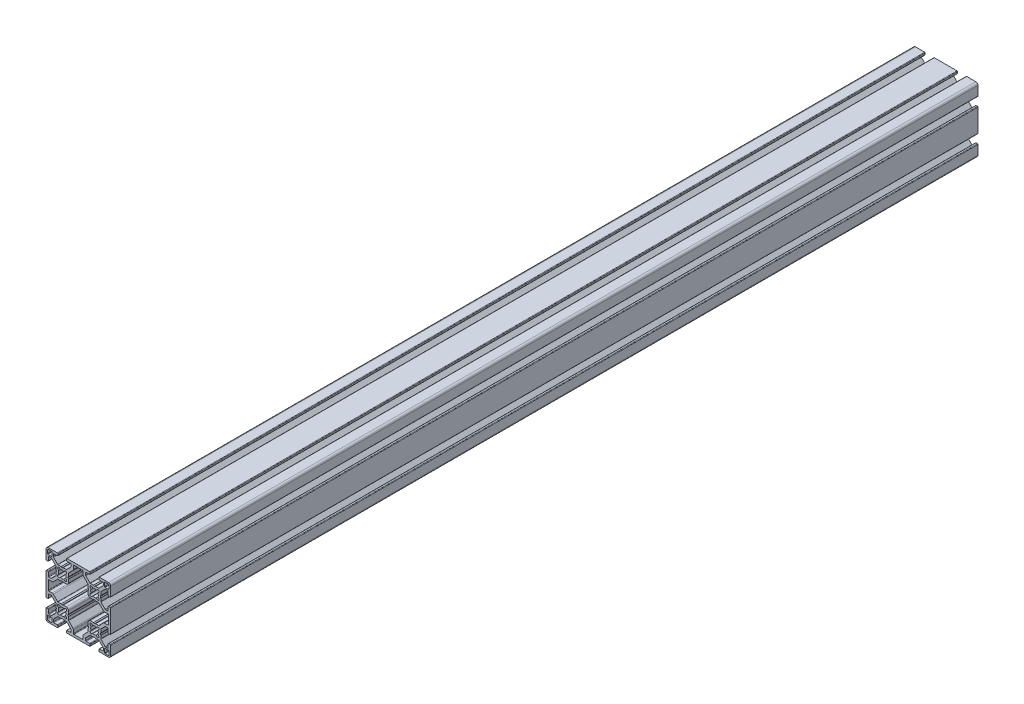
from build123d import *

# Parameters (mm, degrees)
EXTRUDE1_DEPTH     = 805
SKETCH2_R          = 3.175
CUT_EXTRUDE1_DEPTH = 809.486225919
SKETCH3_R          = 3.175
CUT_EXTRUDE2_DEPTH = 809.486226018


with BuildPart() as part:
    # Sketch1 → Extrude1 (new body)
    with BuildSketch(Plane.XY):
        with BuildLine():
            Line((-14.49997, -25.99994), (-13.242500135, -25.99994))
            ThreePointArc((-13.242500135, -25.99994), (-12.888946745, -25.853493391), (-12.742500135, -25.49994))
            Line((-12.742500135, -25.49994), (-12.742500135, -22.267405213))
            ThreePointArc((-12.742500135, -22.267405213), (-12.602474902, -21.902627009), (-12.242805721, -21.7499565))
            Line((-12.242805721, -21.7499565), (-10.260208553, -21.7499565))
            ThreePointArc((-10.260208553, -21.7499565), (-10.068867219, -21.788016658), (-9.906655869, -21.896402817))
            Line((-9.906655869, -21.896402817), (-5.981129731, -25.821928955))
            ThreePointArc((-5.981129731, -25.821928955), (-5.872743572, -25.984140305), (-5.834683414, -26.175481638))
            Line((-5.834683414, -26.175481638), (-5.834683414, -29.112441775))
            Line((-5.834683414, -29.112441775), (-5.324684434, -30.062439875))
            Line((-5.324684434, -30.062439875), (-5.834683414, -31.012437975))
            Line((-5.834683414, -31.012437975), (-5.834683414, -33.824398362))
            ThreePointArc((-5.834683414, -33.824398362), (-5.872743572, -34.015739695), (-5.981129731, -34.177951045))
            Line((-5.981129731, -34.177951045), (-9.906655869, -38.103477183))
            ThreePointArc((-9.906655869, -38.103477183), (-10.068867219, -38.211863342), (-10.260208553, -38.2499235))
            Line((-10.260208553, -38.2499235), (-12.242805721, -38.2499235))
            ThreePointArc((-12.242805721, -38.2499235), (-12.602474902, -38.097252991), (-12.742500135, -37.732474787))
            Line((-12.742500135, -37.732474787), (-12.742500135, -34.49994))
            ThreePointArc((-12.742500135, -34.49994), (-12.888946745, -34.146386609), (-13.242500135, -33.99994))
            Line((-13.242500135, -33.99994), (-14.49997, -33.99994))
            ThreePointArc((-14.49997, -33.99994), (-14.853523391, -34.146386609), (-14.99997, -34.49994))
            Line((-14.99997, -34.49994), (-14.99997, -42.999914))
            ThreePointArc((-14.99997, -42.999914), (-14.414184734, -44.414124734), (-12.999974, -44.99991))
            Line((-12.999974, -44.99991), (-4.5, -44.99991))
            ThreePointArc((-4.5, -44.99991), (-4.146446609, -44.853463391), (-4, -44.49991))
            Line((-4, -44.49991), (-4, -43.242440135))
            ThreePointArc((-4, -43.242440135), (-4.146446609, -42.888886745), (-4.5, -42.742440135))
            Line((-4.5, -42.742440135), (-7.732534787, -42.742440135))
            ThreePointArc((-7.732534787, -42.742440135), (-8.097312991, -42.602414902), (-8.2499835, -42.242745721))
            Line((-8.2499835, -42.242745721), (-8.2499835, -40.260148553))
            ThreePointArc((-8.2499835, -40.260148553), (-8.211923342, -40.068807219), (-8.103537183, -39.906595869))
            Line((-8.103537183, -39.906595869), (-4.178011045, -35.981069731))
            ThreePointArc((-4.178011045, -35.981069731), (-4.015799695, -35.872683572), (-3.824458362, -35.834623414))
            Line((-3.824458362, -35.834623414), (-0.9499981, -35.834623414))
            Line((-0.9499981, -35.834623414), (0, -35.324624434))
            Line((0, -35.324624434), (0.9499981, -35.834623414))
            Line((0.9499981, -35.834623414), (3.824458362, -35.834623414))
            ThreePointArc((3.824458362, -35.834623414), (4.015799695, -35.872683572), (4.178011045, -35.981069731))
            Line((4.178011045, -35.981069731), (8.103537183, -39.906595869))
            ThreePointArc((8.103537183, -39.906595869), (8.211923342, -40.068807219), (8.2499835, -40.260148553))
            Line((8.2499835, -40.260148553), (8.2499835, -42.242745721))
            ThreePointArc((8.2499835, -42.242745721), (8.097312991, -42.602414902), (7.732534787, -42.742440135))
            Line((7.732534787, -42.742440135), (4.5, -42.742440135))
            ThreePointArc((4.5, -42.742440135), (4.146446609, -42.888886745), (4, -43.242440135))
            Line((4, -43.242440135), (4, -44.49991))
            ThreePointArc((4, -44.49991), (4.146446609, -44.853463391), (4.5, -44.99991))
            Line((4.5, -44.99991), (25.49994, -44.99991))
            ThreePointArc((25.49994, -44.99991), (25.853493391, -44.853463391), (25.99994, -44.49991))
            Line((25.99994, -44.49991), (25.99994, -43.242440135))
            ThreePointArc((25.99994, -43.242440135), (25.853493391, -42.888886745), (25.49994, -42.742440135))
            Line((25.49994, -42.742440135), (22.267405213, -42.742440135))
            ThreePointArc((22.267405213, -42.742440135), (21.902627009, -42.602414902), (21.7499565, -42.242745721))
            Line((21.7499565, -42.242745721), (21.7499565, -40.260148553))
            ThreePointArc((21.7499565, -40.260148553), (21.788016658, -40.068807219), (21.896402817, -39.906595869))
            Line((21.896402817, -39.906595869), (25.821928955, -35.981069731))
            ThreePointArc((25.821928955, -35.981069731), (25.984140305, -35.872683572), (26.175481638, -35.834623414))
            Line((26.175481638, -35.834623414), (29.0499419, -35.834623414))
            Line((29.0499419, -35.834623414), (29.99994, -35.324624434))
            Line((29.99994, -35.324624434), (30.9499381, -35.834623414))
            Line((30.9499381, -35.834623414), (33.824398362, -35.834623414))
            ThreePointArc((33.824398362, -35.834623414), (34.015739695, -35.872683572), (34.177951045, -35.981069731))
            Line((34.177951045, -35.981069731), (38.103477183, -39.906595869))
            ThreePointArc((38.103477183, -39.906595869), (38.211863342, -40.068807219), (38.2499235, -40.260148553))
            Line((38.2499235, -40.260148553), (38.2499235, -42.242745721))
            ThreePointArc((38.2499235, -42.242745721), (38.097252991, -42.602414902), (37.732474787, -42.742440135))
            Line((37.732474787, -42.742440135), (34.49994, -42.742440135))
            ThreePointArc((34.49994, -42.742440135), (34.146386609, -42.888886745), (33.99994, -43.242440135))
            Line((33.99994, -43.242440135), (33.99994, -44.49991))
            ThreePointArc((33.99994, -44.49991), (34.146386609, -44.853463391), (34.49994, -44.99991))
            Line((34.49994, -44.99991), (42.999914, -44.99991))
            ThreePointArc((42.999914, -44.99991), (44.414124734, -44.414124734), (44.99991, -42.999914))
            Line((44.99991, -42.999914), (44.99991, -34.49994))
            ThreePointArc((44.99991, -34.49994), (44.853463391, -34.146386609), (44.49991, -33.99994))
            Line((44.49991, -33.99994), (43.242440135, -33.99994))
            ThreePointArc((43.242440135, -33.99994), (42.888886745, -34.146386609), (42.742440135, -34.49994))
            Line((42.742440135, -34.49994), (42.742440135, -37.732474787))
            ThreePointArc((42.742440135, -37.732474787), (42.602414902, -38.097252991), (42.242745721, -38.2499235))
            Line((42.242745721, -38.2499235), (40.260148553, -38.2499235))
            ThreePointArc((40.260148553, -38.2499235), (40.068807219, -38.211863342), (39.906595869, -38.103477183))
            Line((39.906595869, -38.103477183), (35.981069731, -34.177951045))
            ThreePointArc((35.981069731, -34.177951045), (35.872683572, -34.015739695), (35.834623414, -33.824398362))
            Line((35.834623414, -33.824398362), (35.834623414, -31.012437975))
            Line((35.834623414, -31.012437975), (35.324624434, -30.062439875))
            Line((35.324624434, -30.062439875), (35.834623414, -29.112441775))
            Line((35.834623414, -29.112441775), (35.834623414, -26.175481638))
            ThreePointArc((35.834623414, -26.175481638), (35.872683572, -25.984140305), (35.981069731, -25.821928955))
            Line((35.981069731, -25.821928955), (39.906595869, -21.896402817))
            ThreePointArc((39.906595869, -21.896402817), (40.068807219, -21.788016658), (40.260148553, -21.7499565))
            Line((40.260148553, -21.7499565), (42.242745721, -21.7499565))
            ThreePointArc((42.242745721, -21.7499565), (42.602414902, -21.902627009), (42.742440135, -22.267405213))
            Line((42.742440135, -22.267405213), (42.742440135, -25.49994))
            ThreePointArc((42.742440135, -25.49994), (42.888886745, -25.853493391), (43.242440135, -25.99994))
            Line((43.242440135, -25.99994), (44.49991, -25.99994))
            ThreePointArc((44.49991, -25.99994), (44.853463391, -25.853493391), (44.99991, -25.49994))
            Line((44.99991, -25.49994), (44.99991, -4.5))
            ThreePointArc((44.99991, -4.5), (44.853463391, -4.146446609), (44.49991, -4))
            Line((44.49991, -4), (43.242440135, -4))
            ThreePointArc((43.242440135, -4), (42.888886745, -4.146446609), (42.742440135, -4.5))
            Line((42.742440135, -4.5), (42.742440135, -7.732534787))
            ThreePointArc((42.742440135, -7.732534787), (42.602414902, -8.097312991), (42.242745721, -8.2499835))
            Line((42.242745721, -8.2499835), (40.260148553, -8.2499835))
            ThreePointArc((40.260148553, -8.2499835), (40.068807219, -8.211923342), (39.906595869, -8.103537183))
            Line((39.906595869, -8.103537183), (35.981069731, -4.178011045))
            ThreePointArc((35.981069731, -4.178011045), (35.872683572, -4.015799695), (35.834623414, -3.824458362))
            Line((35.834623414, -3.824458362), (35.834623414, -1.012497975))
            Line((35.834623414, -1.012497975), (35.324624434, -0.062499875))
            Line((35.324624434, -0.062499875), (35.834623414, 0.887498225))
            Line((35.834623414, 0.887498225), (35.834623414, 3.824458362))
            ThreePointArc((35.834623414, 3.824458362), (35.872683572, 4.015799695), (35.981069731, 4.178011045))
            Line((35.981069731, 4.178011045), (39.906595869, 8.103537183))
            ThreePointArc((39.906595869, 8.103537183), (40.068807219, 8.211923342), (40.260148553, 8.2499835))
            Line((40.260148553, 8.2499835), (42.242745721, 8.2499835))
            ThreePointArc((42.242745721, 8.2499835), (42.602414902, 8.097312991), (42.742440135, 7.732534787))
            Line((42.742440135, 7.732534787), (42.742440135, 4.5))
            ThreePointArc((42.742440135, 4.5), (42.888886745, 4.146446609), (43.242440135, 4))
            Line((43.242440135, 4), (44.49991, 4))
            ThreePointArc((44.49991, 4), (44.853463391, 4.146446609), (44.99991, 4.5))
            Line((44.99991, 4.5), (44.99991, 12.999974))
            ThreePointArc((44.99991, 12.999974), (44.414124734, 14.414184734), (42.999914, 14.99997))
            Line((42.999914, 14.99997), (34.49994, 14.99997))
            ThreePointArc((34.49994, 14.99997), (34.146386609, 14.853523391), (33.99994, 14.49997))
            Line((33.99994, 14.49997), (33.99994, 13.242500135))
            ThreePointArc((33.99994, 13.242500135), (34.146386609, 12.888946745), (34.49994, 12.742500135))
            Line((34.49994, 12.742500135), (37.732474787, 12.742500135))
            ThreePointArc((37.732474787, 12.742500135), (38.097252991, 12.602474902), (38.2499235, 12.242805721))
            Line((38.2499235, 12.242805721), (38.2499235, 10.260208553))
            ThreePointArc((38.2499235, 10.260208553), (38.211863342, 10.068867219), (38.103477183, 9.906655869))
            Line((38.103477183, 9.906655869), (34.177951045, 5.981129731))
            ThreePointArc((34.177951045, 5.981129731), (34.015739695, 5.872743572), (33.824398362, 5.834683414))
            Line((33.824398362, 5.834683414), (30.9499381, 5.834683414))
            Line((30.9499381, 5.834683414), (29.99994, 5.324684434))
            Line((29.99994, 5.324684434), (29.0499419, 5.834683414))
            Line((29.0499419, 5.834683414), (26.175481638, 5.834683414))
            ThreePointArc((26.175481638, 5.834683414), (25.984140305, 5.872743572), (25.821928955, 5.981129731))
            Line((25.821928955, 5.981129731), (21.896402817, 9.906655869))
            ThreePointArc((21.896402817, 9.906655869), (21.788016658, 10.068867219), (21.7499565, 10.260208553))
            Line((21.7499565, 10.260208553), (21.7499565, 12.242805721))
            ThreePointArc((21.7499565, 12.242805721), (21.902627009, 12.602474902), (22.267405213, 12.742500135))
            Line((22.267405213, 12.742500135), (25.49994, 12.742500135))
            ThreePointArc((25.49994, 12.742500135), (25.853493391, 12.888946745), (25.99994, 13.242500135))
            Line((25.99994, 13.242500135), (25.99994, 14.49997))
            ThreePointArc((25.99994, 14.49997), (25.853493391, 14.853523391), (25.49994, 14.99997))
            Line((25.49994, 14.99997), (4.5, 14.99997))
            ThreePointArc((4.5, 14.99997), (4.146446609, 14.853523391), (4, 14.49997))
            Line((4, 14.49997), (4, 13.242500135))
            ThreePointArc((4, 13.242500135), (4.146446609, 12.888946745), (4.5, 12.742500135))
            Line((4.5, 12.742500135), (7.732534787, 12.742500135))
            ThreePointArc((7.732534787, 12.742500135), (8.097312991, 12.602474902), (8.2499835, 12.242805721))
            Line((8.2499835, 12.242805721), (8.2499835, 10.260208553))
            ThreePointArc((8.2499835, 10.260208553), (8.211923342, 10.068867219), (8.103537183, 9.906655869))
            Line((8.103537183, 9.906655869), (4.178011045, 5.981129731))
            ThreePointArc((4.178011045, 5.981129731), (4.015799695, 5.872743572), (3.824458362, 5.834683414))
            Line((3.824458362, 5.834683414), (0.9499981, 5.834683414))
            Line((0.9499981, 5.834683414), (0, 5.324684434))
            Line((0, 5.324684434), (-0.9499981, 5.834683414))
            Line((-0.9499981, 5.834683414), (-3.824458362, 5.834683414))
            ThreePointArc((-3.824458362, 5.834683414), (-4.015799695, 5.872743572), (-4.178011045, 5.981129731))
            Line((-4.178011045, 5.981129731), (-8.103537183, 9.906655869))
            ThreePointArc((-8.103537183, 9.906655869), (-8.211923342, 10.068867219), (-8.2499835, 10.260208553))
            Line((-8.2499835, 10.260208553), (-8.2499835, 12.242805721))
            ThreePointArc((-8.2499835, 12.242805721), (-8.097312991, 12.602474902), (-7.732534787, 12.742500135))
            Line((-7.732534787, 12.742500135), (-4.5, 12.742500135))
            ThreePointArc((-4.5, 12.742500135), (-4.146446609, 12.888946745), (-4, 13.242500135))
            Line((-4, 13.242500135), (-4, 14.49997))
            ThreePointArc((-4, 14.49997), (-4.146446609, 14.853523391), (-4.5, 14.99997))
            Line((-4.5, 14.99997), (-12.999974, 14.99997))
            ThreePointArc((-12.999974, 14.99997), (-14.414184734, 14.414184734), (-14.99997, 12.999974))
            Line((-14.99997, 12.999974), (-14.99997, 4.5))
            ThreePointArc((-14.99997, 4.5), (-14.853523391, 4.146446609), (-14.49997, 4))
            Line((-14.49997, 4), (-13.242500135, 4))
            ThreePointArc((-13.242500135, 4), (-12.888946745, 4.146446609), (-12.742500135, 4.5))
            Line((-12.742500135, 4.5), (-12.742500135, 7.732534787))
            ThreePointArc((-12.742500135, 7.732534787), (-12.602474902, 8.097312991), (-12.242805721, 8.2499835))
            Line((-12.242805721, 8.2499835), (-10.260208553, 8.2499835))
            ThreePointArc((-10.260208553, 8.2499835), (-10.068867219, 8.211923342), (-9.906655869, 8.103537183))
            Line((-9.906655869, 8.103537183), (-5.981129731, 4.178011045))
            ThreePointArc((-5.981129731, 4.178011045), (-5.872743572, 4.015799695), (-5.834683414, 3.824458362))
            Line((-5.834683414, 3.824458362), (-5.834683414, 0.887498225))
            Line((-5.834683414, 0.887498225), (-5.324684434, -0.062499875))
            Line((-5.324684434, -0.062499875), (-5.834683414, -1.012497975))
            Line((-5.834683414, -1.012497975), (-5.834683414, -3.824458362))
            ThreePointArc((-5.834683414, -3.824458362), (-5.872743572, -4.015799695), (-5.981129731, -4.178011045))
            Line((-5.981129731, -4.178011045), (-9.906655869, -8.103537183))
            ThreePointArc((-9.906655869, -8.103537183), (-10.068867219, -8.211923342), (-10.260208553, -8.2499835))
            Line((-10.260208553, -8.2499835), (-12.242805721, -8.2499835))
            ThreePointArc((-12.242805721, -8.2499835), (-12.602474902, -8.097312991), (-12.742500135, -7.732534787))
            Line((-12.742500135, -7.732534787), (-12.742500135, -4.5))
            ThreePointArc((-12.742500135, -4.5), (-12.888946745, -4.146446609), (-13.242500135, -4))
            Line((-13.242500135, -4), (-14.49997, -4))
            ThreePointArc((-14.49997, -4), (-14.853523391, -4.146446609), (-14.99997, -4.5))
            Line((-14.99997, -4.5), (-14.99997, -25.49994))
            ThreePointArc((-14.99997, -25.49994), (-14.853523391, -25.853493391), (-14.49997, -25.99994))
        make_face()
        with BuildLine():
            Line((-13.318973362, -39.499921), (-9.87998024, -39.499921))
            ThreePointArc((-9.87998024, -39.499921), (-9.611280201, -39.611220201), (-9.499981, -39.87992024))
            Line((-9.499981, -39.87992024), (-9.499981, -43.318913362))
            ThreePointArc((-9.499981, -43.318913362), (-9.611573093, -43.588320507), (-9.880980238, -43.6999126))
            Line((-9.880980238, -43.6999126), (-12.6999746, -43.6999126))
            ThreePointArc((-12.6999746, -43.6999126), (-13.407079967, -43.407019967), (-13.6999726, -42.6999146))
            Line((-13.6999726, -42.6999146), (-13.6999726, -39.880920238))
            ThreePointArc((-13.6999726, -39.880920238), (-13.588380507, -39.611513093), (-13.318973362, -39.499921))
        make_face(mode=Mode.SUBTRACT)
        with BuildLine():
            Line((39.499921, -43.318913362), (39.499921, -39.87992024))
            ThreePointArc((39.499921, -39.87992024), (39.611220201, -39.611220201), (39.87992024, -39.499921))
            Line((39.87992024, -39.499921), (43.318913362, -39.499921))
            ThreePointArc((43.318913362, -39.499921), (43.588320507, -39.611513093), (43.6999126, -39.880920238))
            Line((43.6999126, -39.880920238), (43.6999126, -42.6999146))
            ThreePointArc((43.6999126, -42.6999146), (43.407019967, -43.407019967), (42.6999146, -43.6999126))
            Line((42.6999146, -43.6999126), (39.880920238, -43.6999126))
            ThreePointArc((39.880920238, -43.6999126), (39.611513093, -43.588320507), (39.499921, -43.318913362))
        make_face(mode=Mode.SUBTRACT)
        with BuildLine():
            Line((39.880920238, 13.6999726), (42.6999146, 13.6999726))
            ThreePointArc((42.6999146, 13.6999726), (43.407019967, 13.407079967), (43.6999126, 12.6999746))
            Line((43.6999126, 12.6999746), (43.6999126, 9.880980238))
            ThreePointArc((43.6999126, 9.880980238), (43.588320507, 9.611573093), (43.318913362, 9.499981))
            Line((43.318913362, 9.499981), (39.87992024, 9.499981))
            ThreePointArc((39.87992024, 9.499981), (39.611220201, 9.611280201), (39.499921, 9.87998024))
            Line((39.499921, 9.87998024), (39.499921, 13.318973362))
            ThreePointArc((39.499921, 13.318973362), (39.611513093, 13.588380507), (39.880920238, 13.6999726))
        make_face(mode=Mode.SUBTRACT)
        with BuildLine():
            Line((-9.499981, 13.318973362), (-9.499981, 9.87998024))
            ThreePointArc((-9.499981, 9.87998024), (-9.611280201, 9.611280201), (-9.87998024, 9.499981))
            Line((-9.87998024, 9.499981), (-13.318973362, 9.499981))
            ThreePointArc((-13.318973362, 9.499981), (-13.588380507, 9.611573093), (-13.6999726, 9.880980238))
            Line((-13.6999726, 9.880980238), (-13.6999726, 12.6999746))
            ThreePointArc((-13.6999726, 12.6999746), (-13.407079967, 13.407079967), (-12.6999746, 13.6999726))
            Line((-12.6999746, 13.6999726), (-9.880980238, 13.6999726))
            ThreePointArc((-9.880980238, 13.6999726), (-9.611573093, 13.588380507), (-9.499981, 13.318973362))
        make_face(mode=Mode.SUBTRACT)
        with BuildLine():
            Line((-1.494228237, -3.198145108), (-2.473346769, -3.979935105))
            ThreePointArc((-2.473346769, -3.979935105), (-3.900235502, -3.900235502), (-3.979935105, -2.473346769))
            Line((-3.979935105, -2.473346769), (-3.198145108, -1.494228237))
            ThreePointArc((-3.198145108, -1.494228237), (-3.52999294, 0), (-3.198145108, 1.494228237))
            Line((-3.198145108, 1.494228237), (-3.979935105, 2.473346769))
            ThreePointArc((-3.979935105, 2.473346769), (-3.900235502, 3.900235502), (-2.473346769, 3.979935105))
            Line((-2.473346769, 3.979935105), (-1.494228237, 3.198145108))
            ThreePointArc((-1.494228237, 3.198145108), (0, 3.52999294), (1.494228237, 3.198145108))
            Line((1.494228237, 3.198145108), (2.473346769, 3.979935105))
            ThreePointArc((2.473346769, 3.979935105), (3.900235502, 3.900235502), (3.979935105, 2.473346769))
            Line((3.979935105, 2.473346769), (3.198145108, 1.494228237))
            ThreePointArc((3.198145108, 1.494228237), (3.52999294, 0), (3.198145108, -1.494228237))
            Line((3.198145108, -1.494228237), (3.979935105, -2.473346769))
            ThreePointArc((3.979935105, -2.473346769), (3.900235502, -3.900235502), (2.473346769, -3.979935105))
            Line((2.473346769, -3.979935105), (1.494228237, -3.198145108))
            ThreePointArc((1.494228237, -3.198145108), (0, -3.52999294), (-1.494228237, -3.198145108))
        make_face(mode=Mode.SUBTRACT)
        with BuildLine():
            Line((28.505711763, -3.198145108), (27.526593231, -3.979935105))
            ThreePointArc((27.526593231, -3.979935105), (26.099704498, -3.900235502), (26.020004895, -2.473346769))
            Line((26.020004895, -2.473346769), (26.801794892, -1.494228237))
            ThreePointArc((26.801794892, -1.494228237), (26.46994706, 0), (26.801794892, 1.494228237))
            Line((26.801794892, 1.494228237), (26.020004895, 2.473346769))
            ThreePointArc((26.020004895, 2.473346769), (26.099704498, 3.900235502), (27.526593231, 3.979935105))
            Line((27.526593231, 3.979935105), (28.505711763, 3.198145108))
            ThreePointArc((28.505711763, 3.198145108), (29.99994, 3.52999294), (31.494168237, 3.198145108))
            Line((31.494168237, 3.198145108), (32.473286769, 3.979935105))
            ThreePointArc((32.473286769, 3.979935105), (33.900175502, 3.900235502), (33.979875105, 2.473346769))
            Line((33.979875105, 2.473346769), (33.198085108, 1.494228237))
            ThreePointArc((33.198085108, 1.494228237), (33.52993294, 0), (33.198085108, -1.494228237))
            Line((33.198085108, -1.494228237), (33.979875105, -2.473346769))
            ThreePointArc((33.979875105, -2.473346769), (33.900175502, -3.900235502), (32.473286769, -3.979935105))
            Line((32.473286769, -3.979935105), (31.494168237, -3.198145108))
            ThreePointArc((31.494168237, -3.198145108), (29.99994, -3.52999294), (28.505711763, -3.198145108))
        make_face(mode=Mode.SUBTRACT)
        with BuildLine():
            Line((-1.494228237, -33.198085108), (-2.473346769, -33.979875105))
            ThreePointArc((-2.473346769, -33.979875105), (-3.900235502, -33.900175502), (-3.979935105, -32.473286769))
            Line((-3.979935105, -32.473286769), (-3.198145108, -31.494168237))
            ThreePointArc((-3.198145108, -31.494168237), (-3.52999294, -29.99994), (-3.198145108, -28.505711763))
            Line((-3.198145108, -28.505711763), (-3.979935105, -27.526593231))
            ThreePointArc((-3.979935105, -27.526593231), (-3.900235502, -26.099704498), (-2.473346769, -26.020004895))
            Line((-2.473346769, -26.020004895), (-1.494228237, -26.801794892))
            ThreePointArc((-1.494228237, -26.801794892), (0, -26.46994706), (1.494228237, -26.801794892))
            Line((1.494228237, -26.801794892), (2.473346769, -26.020004895))
            ThreePointArc((2.473346769, -26.020004895), (3.900235502, -26.099704498), (3.979935105, -27.526593231))
            Line((3.979935105, -27.526593231), (3.198145108, -28.505711763))
            ThreePointArc((3.198145108, -28.505711763), (3.52999294, -29.99994), (3.198145108, -31.494168237))
            Line((3.198145108, -31.494168237), (3.979935105, -32.473286769))
            ThreePointArc((3.979935105, -32.473286769), (3.900235502, -33.900175502), (2.473346769, -33.979875105))
            Line((2.473346769, -33.979875105), (1.494228237, -33.198085108))
            ThreePointArc((1.494228237, -33.198085108), (0, -33.52993294), (-1.494228237, -33.198085108))
        make_face(mode=Mode.SUBTRACT)
        with BuildLine():
            Line((28.505711763, -33.198085108), (27.526593231, -33.979875105))
            ThreePointArc((27.526593231, -33.979875105), (26.099704498, -33.900175502), (26.020004895, -32.473286769))
            Line((26.020004895, -32.473286769), (26.801794892, -31.494168237))
            ThreePointArc((26.801794892, -31.494168237), (26.46994706, -29.99994), (26.801794892, -28.505711763))
            Line((26.801794892, -28.505711763), (26.020004895, -27.526593231))
            ThreePointArc((26.020004895, -27.526593231), (26.099704498, -26.099704498), (27.526593231, -26.020004895))
            Line((27.526593231, -26.020004895), (28.505711763, -26.801794892))
            ThreePointArc((28.505711763, -26.801794892), (29.99994, -26.46994706), (31.494168237, -26.801794892))
            Line((31.494168237, -26.801794892), (32.473286769, -26.020004895))
            ThreePointArc((32.473286769, -26.020004895), (33.900175502, -26.099704498), (33.979875105, -27.526593231))
            Line((33.979875105, -27.526593231), (33.198085108, -28.505711763))
            ThreePointArc((33.198085108, -28.505711763), (33.52993294, -29.99994), (33.198085108, -31.494168237))
            Line((33.198085108, -31.494168237), (33.979875105, -32.473286769))
            ThreePointArc((33.979875105, -32.473286769), (33.900175502, -33.900175502), (32.473286769, -33.979875105))
            Line((32.473286769, -33.979875105), (31.494168237, -33.198085108))
            ThreePointArc((31.494168237, -33.198085108), (29.99994, -33.52993294), (28.505711763, -33.198085108))
        make_face(mode=Mode.SUBTRACT)
        with BuildLine():
            Line((42.7999144, -10.9499781), (42.7999144, -19.0499619))
            ThreePointArc((42.7999144, -19.0499619), (42.653468083, -19.403514583), (42.2999154, -19.5499609))
            Line((42.2999154, -19.5499609), (39.268119515, -19.5499609))
            ThreePointArc((39.268119515, -19.5499609), (38.694095515, -19.664141373), (38.207461465, -19.98929985))
            Line((38.207461465, -19.98929985), (34.177951045, -24.018810269))
            ThreePointArc((34.177951045, -24.018810269), (34.015739695, -24.127196428), (33.824398362, -24.165256586))
            Line((33.824398362, -24.165256586), (30.9499381, -24.165256586))
            Line((30.9499381, -24.165256586), (29.99994, -24.675255566))
            Line((29.99994, -24.675255566), (29.0499419, -24.165256586))
            Line((29.0499419, -24.165256586), (26.165252586, -24.165256586))
            ThreePointArc((26.165252586, -24.165256586), (24.751041852, -24.751041852), (24.165256586, -26.165252586))
            Line((24.165256586, -26.165252586), (24.165256586, -29.112441775))
            Line((24.165256586, -29.112441775), (24.675255566, -30.062439875))
            Line((24.675255566, -30.062439875), (24.165256586, -31.012437975))
            Line((24.165256586, -31.012437975), (24.165256586, -33.824398362))
            ThreePointArc((24.165256586, -33.824398362), (24.127196428, -34.015739695), (24.018810269, -34.177951045))
            Line((24.018810269, -34.177951045), (19.98929985, -38.207461465))
            ThreePointArc((19.98929985, -38.207461465), (19.664141373, -38.694095515), (19.5499609, -39.268119515))
            Line((19.5499609, -39.268119515), (19.5499609, -42.2999154))
            ThreePointArc((19.5499609, -42.2999154), (19.403514583, -42.653468083), (19.0499619, -42.7999144))
            Line((19.0499619, -42.7999144), (10.9499781, -42.7999144))
            ThreePointArc((10.9499781, -42.7999144), (10.596425417, -42.653468083), (10.4499791, -42.2999154))
            Line((10.4499791, -42.2999154), (10.4499791, -39.268119515))
            ThreePointArc((10.4499791, -39.268119515), (10.335798627, -38.694095515), (10.01064015, -38.207461465))
            Line((10.01064015, -38.207461465), (5.981129731, -34.177951045))
            ThreePointArc((5.981129731, -34.177951045), (5.872743572, -34.015739695), (5.834683414, -33.824398362))
            Line((5.834683414, -33.824398362), (5.834683414, -31.012437975))
            Line((5.834683414, -31.012437975), (5.324684434, -30.062439875))
            Line((5.324684434, -30.062439875), (5.834683414, -29.112441775))
            Line((5.834683414, -29.112441775), (5.834683414, -26.165252586))
            ThreePointArc((5.834683414, -26.165252586), (5.248898148, -24.751041852), (3.834687414, -24.165256586))
            Line((3.834687414, -24.165256586), (0.9499981, -24.165256586))
            Line((0.9499981, -24.165256586), (0, -24.675255566))
            Line((0, -24.675255566), (-0.9499981, -24.165256586))
            Line((-0.9499981, -24.165256586), (-3.824458362, -24.165256586))
            ThreePointArc((-3.824458362, -24.165256586), (-4.015799695, -24.127196428), (-4.178011045, -24.018810269))
            Line((-4.178011045, -24.018810269), (-8.207521465, -19.98929985))
            ThreePointArc((-8.207521465, -19.98929985), (-8.694155515, -19.664141373), (-9.268179515, -19.5499609))
            Line((-9.268179515, -19.5499609), (-12.2999754, -19.5499609))
            ThreePointArc((-12.2999754, -19.5499609), (-12.653528083, -19.403514583), (-12.7999744, -19.0499619))
            Line((-12.7999744, -19.0499619), (-12.7999744, -10.9499781))
            ThreePointArc((-12.7999744, -10.9499781), (-12.653528083, -10.596425417), (-12.2999754, -10.4499791))
            Line((-12.2999754, -10.4499791), (-9.268179515, -10.4499791))
            ThreePointArc((-9.268179515, -10.4499791), (-8.694155515, -10.335798627), (-8.207521465, -10.01064015))
            Line((-8.207521465, -10.01064015), (-4.178011045, -5.981129731))
            ThreePointArc((-4.178011045, -5.981129731), (-4.015799695, -5.872743572), (-3.824458362, -5.834683414))
            Line((-3.824458362, -5.834683414), (-0.9499981, -5.834683414))
            Line((-0.9499981, -5.834683414), (0, -5.324684434))
            Line((0, -5.324684434), (0.9499981, -5.834683414))
            Line((0.9499981, -5.834683414), (3.834687414, -5.834683414))
            ThreePointArc((3.834687414, -5.834683414), (5.248898148, -5.248898148), (5.834683414, -3.834687414))
            Line((5.834683414, -3.834687414), (5.834683414, -1.012497975))
            Line((5.834683414, -1.012497975), (5.324684434, -0.062499875))
            Line((5.324684434, -0.062499875), (5.834683414, 0.887498225))
            Line((5.834683414, 0.887498225), (5.834683414, 3.824458362))
            ThreePointArc((5.834683414, 3.824458362), (5.872743572, 4.015799695), (5.981129731, 4.178011045))
            Line((5.981129731, 4.178011045), (10.01064015, 8.207521465))
            ThreePointArc((10.01064015, 8.207521465), (10.335798627, 8.694155515), (10.4499791, 9.268179515))
            Line((10.4499791, 9.268179515), (10.4499791, 12.2999754))
            ThreePointArc((10.4499791, 12.2999754), (10.596425417, 12.653528083), (10.9499781, 12.7999744))
            Line((10.9499781, 12.7999744), (19.0499619, 12.7999744))
            ThreePointArc((19.0499619, 12.7999744), (19.403514583, 12.653528083), (19.5499609, 12.2999754))
            Line((19.5499609, 12.2999754), (19.5499609, 9.268179515))
            ThreePointArc((19.5499609, 9.268179515), (19.664141373, 8.694155515), (19.98929985, 8.207521465))
            Line((19.98929985, 8.207521465), (24.018810269, 4.178011045))
            ThreePointArc((24.018810269, 4.178011045), (24.127196428, 4.015799695), (24.165256586, 3.824458362))
            Line((24.165256586, 3.824458362), (24.165256586, 0.887498225))
            Line((24.165256586, 0.887498225), (24.675255566, -0.062499875))
            Line((24.675255566, -0.062499875), (24.165256586, -1.012497975))
            Line((24.165256586, -1.012497975), (24.165256586, -3.834687414))
            ThreePointArc((24.165256586, -3.834687414), (24.751041852, -5.248898148), (26.165252586, -5.834683414))
            Line((26.165252586, -5.834683414), (29.0499419, -5.834683414))
            Line((29.0499419, -5.834683414), (29.99994, -5.324684434))
            Line((29.99994, -5.324684434), (30.9499381, -5.834683414))
            Line((30.9499381, -5.834683414), (33.824398362, -5.834683414))
            ThreePointArc((33.824398362, -5.834683414), (34.015739695, -5.872743572), (34.177951045, -5.981129731))
            Line((34.177951045, -5.981129731), (38.207461465, -10.01064015))
            ThreePointArc((38.207461465, -10.01064015), (38.694095515, -10.335798627), (39.268119515, -10.4499791))
            Line((39.268119515, -10.4499791), (42.2999154, -10.4499791))
            ThreePointArc((42.2999154, -10.4499791), (42.653468083, -10.596425417), (42.7999144, -10.9499781))
        make_face(mode=Mode.SUBTRACT)
    extrude(amount=-EXTRUDE1_DEPTH)

    # Sketch2 → Cut-Extrude1 (cut, through all)
    with BuildSketch(Plane(origin=(0, 14.99997, 0), x_dir=(1, 0, 0), z_dir=(0, 1, 0))):
        with Locations((0, 65)):
            Circle(SKETCH2_R)
        with Locations((0, 790)):
            Circle(SKETCH2_R)
        with Locations((0, 760)):
            Circle(SKETCH2_R)
        with Locations((0, 595)):
            Circle(SKETCH2_R)
    extrude(amount=-CUT_EXTRUDE1_DEPTH, mode=Mode.SUBTRACT)

    # Sketch3 → Cut-Extrude2 (cut, through all)
    with BuildSketch(Plane.ZY.offset(14.99997)):
        with Locations((-790, -0.062499875)):
            Circle(SKETCH3_R)
        with Locations((-760, -0.062499875)):
            Circle(SKETCH3_R)
        with Locations((-595, -0.062499875)):
            Circle(SKETCH3_R)
        with Locations((-65, -0.062499875)):
            Circle(SKETCH3_R)
    extrude(amount=-CUT_EXTRUDE2_DEPTH, mode=Mode.SUBTRACT)


solid = part.part
